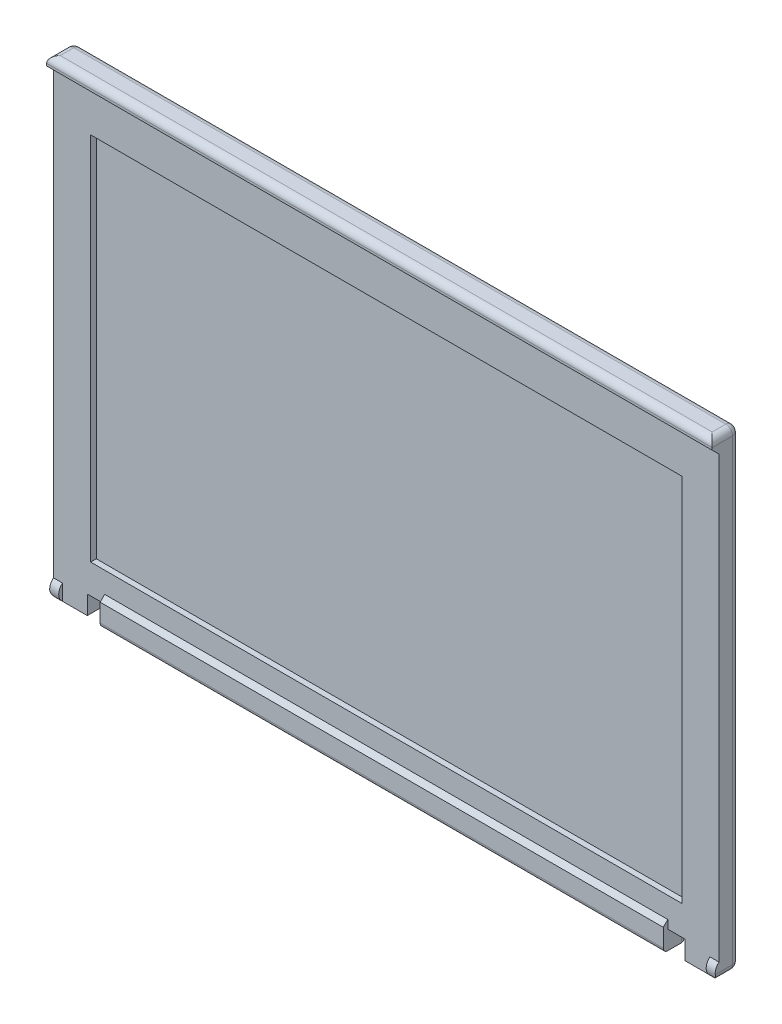
from build123d import *

# Parameters (mm, degrees)
SKETCH1_W           = 295
SKETCH1_H           = 209
BOSS_EXTRUDE1_DEPTH = 9
SKETCH2_W           = 262
SKETCH2_H           = 164
CUT_EXTRUDE1_DEPTH  = 2.5
SKETCH3_W           = 3
SKETCH3_H           = 3
BOSS_EXTRUDE2_DEPTH = 295
CHAMFER1_SIZE       = 4
SKETCH4_W           = 7.7
SKETCH4_H           = 8.3
CUT_EXTRUDE2_DEPTH  = 250
BOSS_EXTRUDE3_DEPTH = 4
SKETCH6_W           = 249.6
SKETCH6_H           = 10
BOSS_EXTRUDE4_DEPTH = 2
CHAMFER2_SIZE       = 2
FILLET1_R           = 2
FILLET2_R           = 3


# Some blends are built 0.0001 mm under size
with BuildPart() as part:
    # Sketch1 → Boss-Extrude1 (new body)
    with BuildSketch(Plane.XY):
        Rectangle(SKETCH1_W, SKETCH1_H)
    extrude(amount=BOSS_EXTRUDE1_DEPTH)

    # Sketch2 → Cut-Extrude1 (cut)
    with BuildSketch(Plane.XY.offset(9)):
        with Locations((0, -1.2)):
            Rectangle(SKETCH2_W, SKETCH2_H)
    extrude(amount=-CUT_EXTRUDE1_DEPTH, mode=Mode.SUBTRACT)

    # Sketch3 → Boss-Extrude2 (add)
    with BuildSketch(Plane(origin=(147.5, 0, 0), x_dir=(0, 0, -1), z_dir=(1, 0, 0))):
        with Locations((-10.5, 103)):
            Rectangle(SKETCH3_W, SKETCH3_H)
    extrude(amount=-BOSS_EXTRUDE2_DEPTH)

    # Chamfer1
    # the kernel refuses this chamfer: 4 mm, written as the material it adds along each edge
    with BuildSketch(Plane(origin=(147.5, 101.5, 9), x_dir=(0, -0.9996219169112968, -0.02749587661058651), z_dir=(-1, 0, 0))) as chamfer1_piece_1_section:
        Polygon((CHAMFER1_SIZE * 0.999621916911, CHAMFER1_SIZE * 0.0274958766106), (-CHAMFER1_SIZE * 0.0274958766106, CHAMFER1_SIZE * 0.999621916911), (0, 0), align=None)
    chamfer1_piece_1 = extrude(amount=295, mode=Mode.PRIVATE)
    chamfer1_piece_1 = split(chamfer1_piece_1, bisect_by=Plane(origin=(0, 100.092163559, 12), z_dir=(0, 0, -1)), keep=Keep.TOP, mode=Mode.PRIVATE)
    add(chamfer1_piece_1)

    # Sketch4 → Cut-Extrude2 (cut)
    with BuildSketch(Plane.XY.offset(9)):
        with Locations((-128.65, -100.35)):
            Rectangle(SKETCH4_W, SKETCH4_H)
        with Locations((128.65, -100.35)):
            Rectangle(SKETCH4_W, SKETCH4_H)
    extrude(amount=-CUT_EXTRUDE2_DEPTH, mode=Mode.SUBTRACT)

    # Sketch5 → Boss-Extrude3 (add)
    with BuildSketch(Plane(origin=(147.5, 0, 0), x_dir=(0, 0, -1), z_dir=(1, 0, 0))):
        with BuildLine():
            Line((-9, -104.5), (-9, -97.5))
            ThreePointArc((-9, -97.5), (-10.671572875, -101), (-9, -104.5))
        make_face()
    boss_extrude3 = extrude(amount=-BOSS_EXTRUDE3_DEPTH)

    # Mirror1: Boss-Extrude3 across plane
    add(boss_extrude3.mirror(Plane(origin=(0, 0, 0), x_dir=(0, 0, 1), z_dir=(1, 0, 0))))

    # Sketch6 → Boss-Extrude4 (add)
    with BuildSketch(Plane.XY.offset(9)):
        with Locations((0, -99.5)):
            Rectangle(SKETCH6_W, SKETCH6_H)
    extrude(amount=BOSS_EXTRUDE4_DEPTH)

    # Chamfer2
    chamfer2_edges = [part.edges().sort_by_distance(p)[0] for p in [
        (0, -94.5, 9),
    ]]
    chamfer(chamfer2_edges, length=CHAMFER2_SIZE - 0.0001)  # a hair under: the kernel refuses the full size

    # Fillet1
    fillet1_edges = [part.edges().sort_by_distance(p)[0] for p in [
        (0, -104.5, 11),
    ]]
    fillet(fillet1_edges, radius=FILLET1_R)

    # Fillet2
    fillet2_edges = [part.edges().sort_by_distance(p)[0] for p in [
        (0, 104.5, 12),
        (0, 104.5, 0),
        (0, -104.5, 0),
        (147.5, 0, 0),
        (-124.8, -100.35, 0),
        (-128.65, -96.2, 0),
        (-132.5, -100.35, 0),
        (-140, -104.5, 0),
        (-147.5, 0, 0),
        (140, -104.5, 0),
        (132.5, -100.35, 0),
        (128.65, -96.2, 0),
        (124.8, -100.35, 0),
        (-147.5, 104.5, 6),
        (147.5, 104.5, 6),
        (147.5, -104.5, 4.5),
        (-147.5, -104.5, 4.5),
    ]]
    fillet(fillet2_edges, radius=FILLET2_R)


solid = part.part
